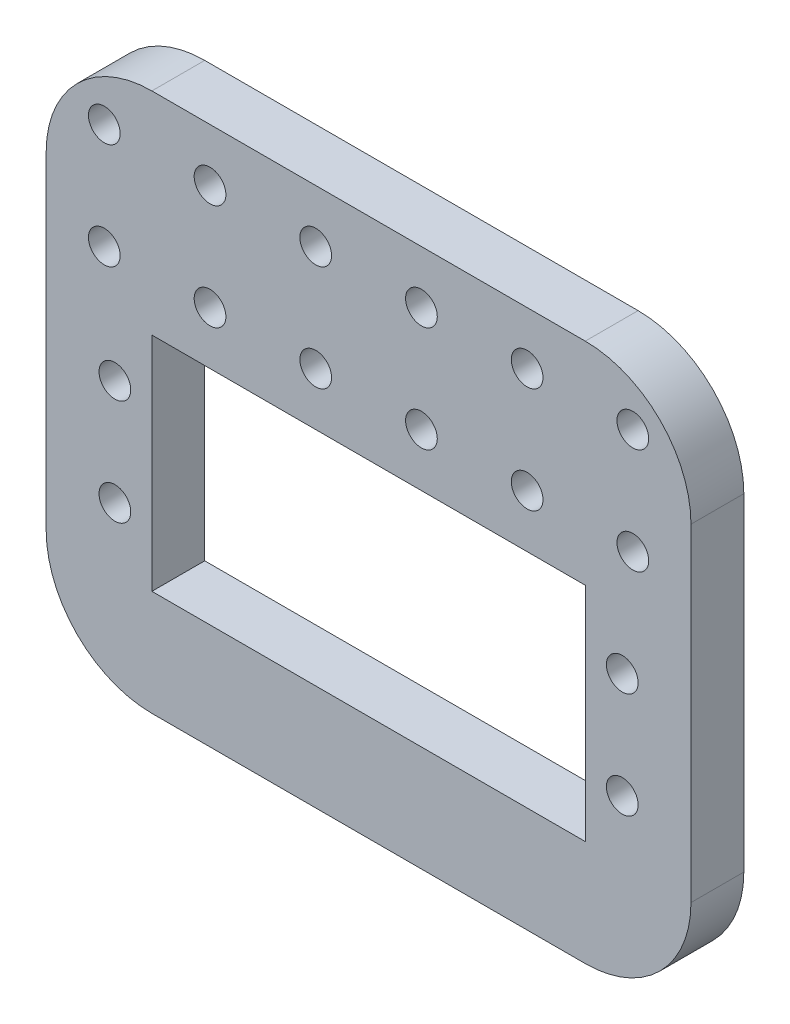
from build123d import *

# Parameters (mm, degrees)
ESQUISSE1_W             = 61
ESQUISSE1_H             = 51
ESQUISSE1_W_2           = 41
ESQUISSE1_H_2           = 21
BOSS_EXTRU_3_DEPTH      = 5
ESQUISSE3_R             = 1.5
ENL_V_MAT_EXTRU_2_DEPTH = 5
ESQUISSE4_R             = 1.5
ENL_V_MAT_EXTRU_3_DEPTH = 5
CONG_1_R                = 10


with BuildPart() as part:
    # Esquisse1 → Boss.-Extru.3 (new body)
    with BuildSketch(Plane.XY):
        with Locations((33.754051088, 5.698759939)):
            Rectangle(ESQUISSE1_W, ESQUISSE1_H)
        with Locations((33.754051088, 0.698759939)):
            Rectangle(ESQUISSE1_W_2, ESQUISSE1_H_2, mode=Mode.SUBTRACT)
    extrude(amount=BOSS_EXTRU_3_DEPTH)

    # Esquisse3 → Enlèv. mat.-Extru.2 (cut)
    with BuildSketch(Plane.XY.offset(5)):
        with Locations((9.754051088, -4.301240061)):
            Circle(ESQUISSE3_R)
        with Locations((9.754051088, 5.698759939)):
            Circle(ESQUISSE3_R)
        with Locations((57.754051088, 5.698759939)):
            Circle(ESQUISSE3_R)
        with Locations((57.754051088, -4.301240061)):
            Circle(ESQUISSE3_R)
    extrude(amount=-ENL_V_MAT_EXTRU_2_DEPTH, mode=Mode.SUBTRACT)

    # Esquisse4 → Enlèv. mat.-Extru.3 (cut)
    with BuildSketch(Plane.XY.offset(5)):
        with Locations((8.754051088, 26.198759939)):
            Circle(ESQUISSE4_R)
        with Locations((18.754051088, 26.198759939)):
            Circle(ESQUISSE4_R)
        with Locations((28.754051088, 26.198759939)):
            Circle(ESQUISSE4_R)
        with Locations((38.754051088, 26.198759939)):
            Circle(ESQUISSE4_R)
        with Locations((48.754051088, 26.198759939)):
            Circle(ESQUISSE4_R)
        with Locations((58.754051088, 26.198759939)):
            Circle(ESQUISSE4_R)
        with Locations((18.754051088, 16.198759939)):
            Circle(ESQUISSE4_R)
        with Locations((28.754051088, 16.198759939)):
            Circle(ESQUISSE4_R)
        with Locations((38.754051088, 16.198759939)):
            Circle(ESQUISSE4_R)
        with Locations((48.754051088, 16.198759939)):
            Circle(ESQUISSE4_R)
        with Locations((58.754051088, 16.198759939)):
            Circle(ESQUISSE4_R)
        with Locations((8.754051088, 16.198759939)):
            Circle(ESQUISSE4_R)
    extrude(amount=-ENL_V_MAT_EXTRU_3_DEPTH, mode=Mode.SUBTRACT)

    # Congé1
    cong_1_edges = [part.edges().sort_by_distance(p)[0] for p in [
        (3.254051088, 31.198759939, 2.5),
        (64.254051088, 31.198759939, 2.5),
        (3.254051088, -19.801240061, 2.5),
        (64.254051088, -19.801240061, 2.5),
    ]]
    fillet(cong_1_edges, radius=CONG_1_R)


solid = part.part
